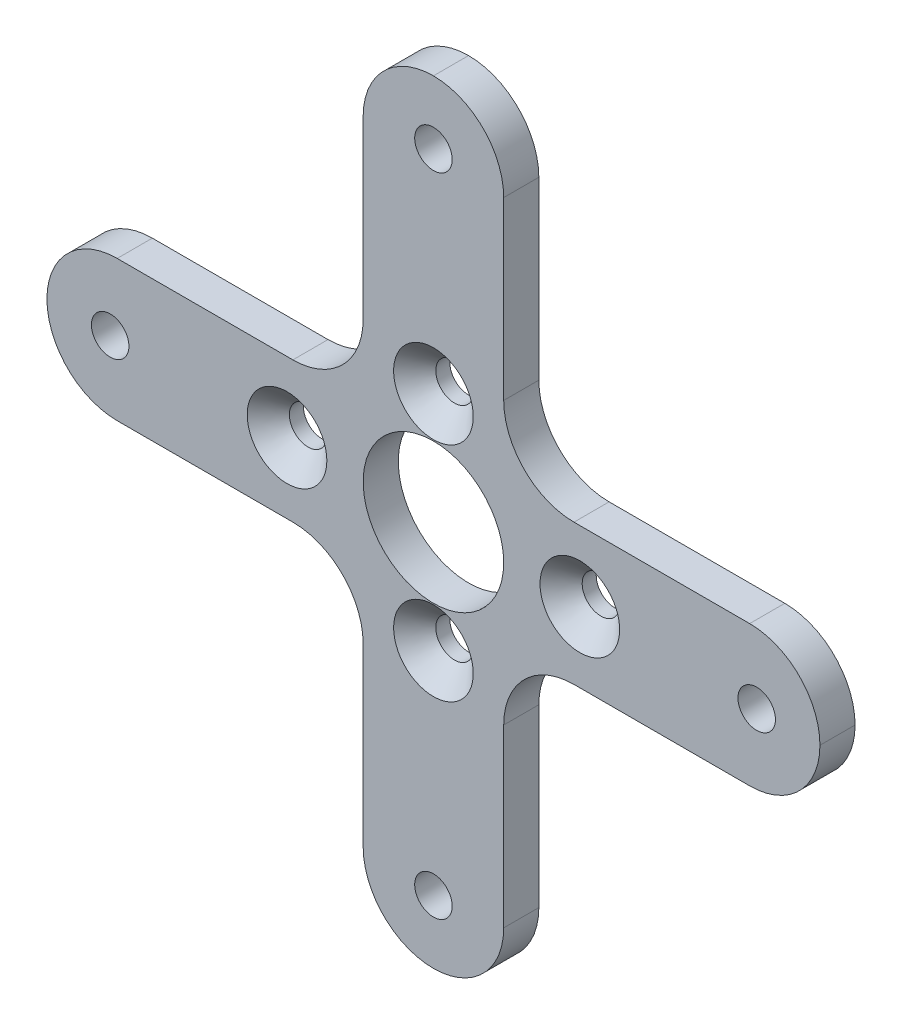
from build123d import *

# Parameters (mm, degrees)
SKETCH_1_R      = 1.6
SKETCH_1_R_2    = 6
EXTRUDE_1_DEPTH = 3
FILLET_1_R      = 6
CHAMFER_1_SIZE  = 1.8


with BuildPart() as part:
    # 草图1 → 凸台-拉伸1 (new body)
    with BuildSketch(Plane.XY):
        Polygon((-6, 0), (6, 0), (6, -27), (33, -27), (33, -39), (6, -39), (6, -66), (-6, -66), (-6, -39), (-33, -39), (-33, -27), (-6, -27), align=None)
        with Locations((0, -5.4)):
            Circle(SKETCH_1_R, mode=Mode.SUBTRACT)
        with Locations((-27.6, -33)):
            Circle(SKETCH_1_R, mode=Mode.SUBTRACT)
        with Locations((27.6, -33)):
            Circle(SKETCH_1_R, mode=Mode.SUBTRACT)
        with Locations((0, -60.6)):
            Circle(SKETCH_1_R, mode=Mode.SUBTRACT)
        with Locations((0, -23.5)):
            Circle(SKETCH_1_R, mode=Mode.SUBTRACT)
        with Locations((12.5, -33)):
            Circle(SKETCH_1_R, mode=Mode.SUBTRACT)
        with Locations((0, -42.5)):
            Circle(SKETCH_1_R, mode=Mode.SUBTRACT)
        with Locations((-12.5, -33)):
            Circle(SKETCH_1_R, mode=Mode.SUBTRACT)
        with Locations((0, -33)):
            Circle(SKETCH_1_R_2, mode=Mode.SUBTRACT)
    extrude(amount=EXTRUDE_1_DEPTH)

    # 圆角1
    fillet_1_edges = [part.edges().sort_by_distance(p)[0] for p in [
        (-6, -39, 1.5),
        (-6, -66, 1.5),
        (6, -66, 1.5),
        (6, -39, 1.5),
        (33, -39, 1.5),
        (33, -27, 1.5),
        (-6, 0, 1.5),
        (6, 0, 1.5),
        (6, -27, 1.5),
        (-6, -27, 1.5),
        (-33, -39, 1.5),
        (-33, -27, 1.5),
    ]]
    fillet(fillet_1_edges, radius=FILLET_1_R - 0.0001)  # a hair under: the kernel refuses the full size

    # 倒角1
    chamfer_1_edges = [part.edges().sort_by_distance(p)[0] for p in [
        (-1.6, -23.5, 3),
        (10.9, -33, 3),
        (-1.6, -42.5, 3),
        (-14.1, -33, 3),
    ]]
    chamfer(chamfer_1_edges, length=CHAMFER_1_SIZE)


solid = part.part
